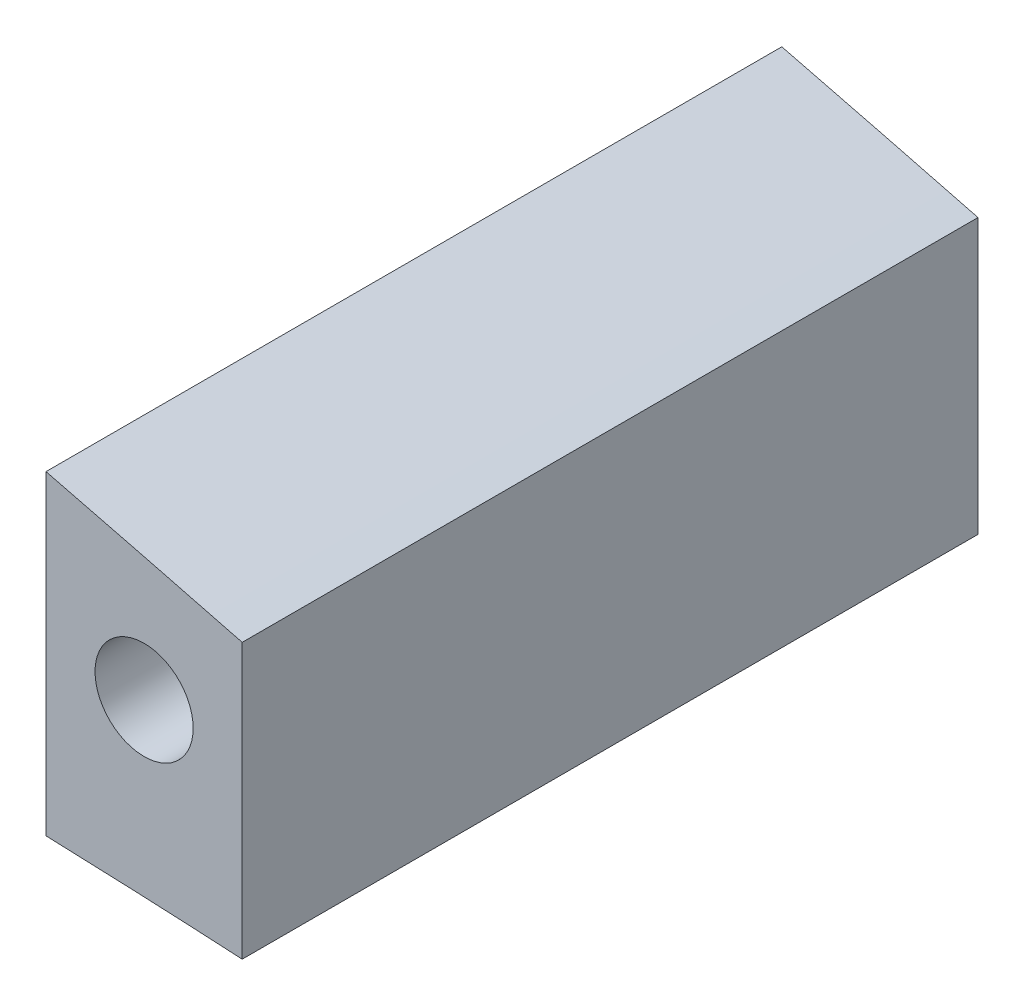
from build123d import *

# Parameters (mm, degrees)
BOSS_EXTRUDE1_DEPTH = 47.625
SKETCH2_R           = 6.35
SKETCH2_R_2         = 3.175
CUT_EXTRUDE1_DEPTH  = 320.299711675
SKETCH3_W           = 116.84
SKETCH3_H           = 50.8
CUT_EXTRUDE2_DEPTH  = 320.299711675
SKETCH4_W           = 250.150530068
SKETCH4_H           = 117.489254048
CUT_EXTRUDE3_DEPTH  = 244.282865836


with BuildPart() as part:
    # Sketch1 → Boss-Extrude1 (new body)
    with BuildSketch(Plane.XY):
        with BuildLine():
            add(Edge.make_bspline(
                [(0.000560351, 0.000130087), (0.810633127, 7.359196055), (8.649092025, 17.856605174), (26.286719818, 29.975176328), (52.111128271, 42.069215275), (89.597618475, 49.290763054), (131.400792109, 47.884831915), (173.256699242, 40.041104278), (217.961060472, 29.612974894), (256.952064401, 19.528920948), (290.35983767, 8.71099439), (301.273197721, 4.382828139), (314.816918223, -0.516206742), (309.846313895, 0.000130087)],
                knots=[0, 0, 0, 0, 0.060863618, 0.113688265, 0.188608742, 0.312908923, 0.448482434, 0.557612135, 0.691544113, 0.852438279, 0.92975597, 0.976058229, 1, 1, 1, 1], degree=3))
            add(Edge.make_bspline(
                [(309.846313895, 0.000130087), (303.956832565, 1.47095521), (293.989507544, 2.093987313), (276.26402299, 4.514356704), (260.846344817, 5.427413394), (235.858814759, 7.870306192), (205.101424636, 8.838080282), (157.718638092, 9.030650149), (110.497331172, 6.181495223), (66.506197185, -0.586669107), (36.454672816, -6.098499901), (15.316603331, -6.189065841), (1.230714189, -6.924076091), (0.000560351, 0.000130087)],
                knots=[0, 0, 0, 0, 0.057787081, 0.095274891, 0.171021118, 0.205339302, 0.335319146, 0.464904334, 0.658702312, 0.785511947, 0.893517288, 0.94309214, 1, 1, 1, 1], degree=3))
        make_face()
    extrude(amount=BOSS_EXTRUDE1_DEPTH)

    # Sketch2 → Cut-Extrude1 (cut, through all)
    with BuildSketch(Plane.XY.offset(47.625)):
        with Locations((20.32, 10.16)):
            Circle(SKETCH2_R)
        with Locations((227.296313895, 19.050130087)):
            Circle(SKETCH2_R_2)
    extrude(amount=-CUT_EXTRUDE1_DEPTH, mode=Mode.SUBTRACT)

    # Sketch3 → Cut-Extrude2 (cut, through all)
    with BuildSketch(Plane.XY.offset(47.625)):
        with Locations((292.066313895, 19.050130087)):
            Rectangle(SKETCH3_W, SKETCH3_H)
    extrude(amount=-CUT_EXTRUDE2_DEPTH, mode=Mode.SUBTRACT)

    # Sketch4 → Cut-Extrude3 (cut, through all)
    with BuildSketch(Plane.XY.offset(47.625)):
        with Locations((95.871048861, 34.528076629)):
            Rectangle(SKETCH4_W, SKETCH4_H)
    extrude(amount=-CUT_EXTRUDE3_DEPTH, mode=Mode.SUBTRACT)


solid = part.part
